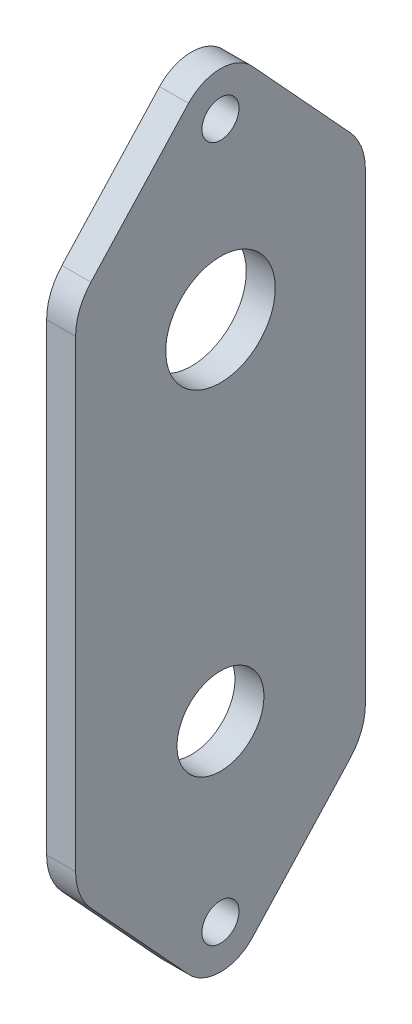
from build123d import *

# Parameters (mm, degrees)
SKETCH1_R           = 2.032
SKETCH1_R_2         = 4.7625
SKETCH1_R_3         = 6
BOSS_EXTRUDE1_DEPTH = 3.175


with BuildPart() as part:
    # Sketch1 → Boss-Extrude1 (new body)
    with BuildSketch(Plane(origin=(0, 0, 0), x_dir=(0, 0, -1), z_dir=(1, 0, 0))):
        with BuildLine():
            Line((-3.505152135, 3.224176602), (-14.198536181, -8.401097865))
            ThreePointArc((-14.198536181, -8.401097865), (-15.441056742, -10.392886516), (-15.875, -12.7))
            Line((-15.875, -12.7), (-15.875, -63.5))
            ThreePointArc((-15.875, -63.5), (-15.441056742, -65.807113484), (-14.198536181, -67.798902135))
            Line((-14.198536181, -67.798902135), (-3.505152135, -79.424176602))
            ThreePointArc((-3.505152135, -79.424176602), (0, -80.9625), (3.505152135, -79.424176602))
            Line((3.505152135, -79.424176602), (14.198536181, -67.798902135))
            ThreePointArc((14.198536181, -67.798902135), (15.441056742, -65.807113484), (15.875, -63.5))
            Line((15.875, -63.5), (15.875, -12.7))
            ThreePointArc((15.875, -12.7), (15.441056742, -10.392886516), (14.198536181, -8.401097865))
            Line((14.198536181, -8.401097865), (3.505152135, 3.224176602))
            ThreePointArc((3.505152135, 3.224176602), (0, 4.7625), (-3.505152135, 3.224176602))
        make_face()
        Circle(SKETCH1_R, mode=Mode.SUBTRACT)
        with Locations((0, -76.2)):
            Circle(SKETCH1_R, mode=Mode.SUBTRACT)
        with Locations((0, -57.15)):
            Circle(SKETCH1_R_2, mode=Mode.SUBTRACT)
        with Locations((0, -19.05)):
            Circle(SKETCH1_R_3, mode=Mode.SUBTRACT)
    extrude(amount=BOSS_EXTRUDE1_DEPTH)


solid = part.part
